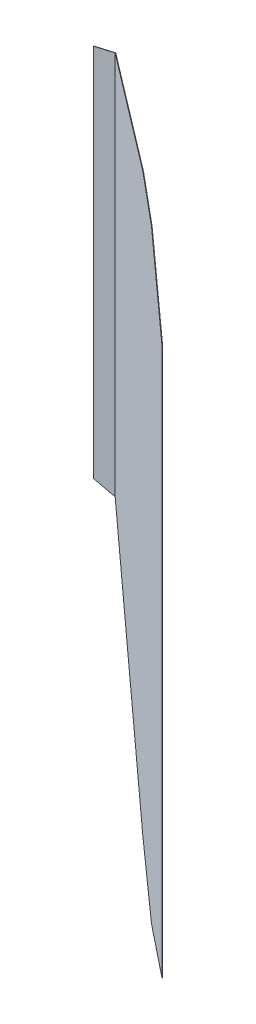
from build123d import *

# Parameters (mm, degrees)
WYCI_GNI_CIE_CIENKA_CIANKA1_DEPTH      = 400
WYCI_GNI_CIE_CIENKA_CIANKA1_DEPTH_BACK = 400


# Read off the part's stored shape, not the designer's step: Lustro1
with BuildPart() as part:
    # Szkic1 → Wyciągnięcie-cienka ścianka1 (new, two sides: drawn at the far end of the back side and taken through both)
    with BuildSketch(Plane(origin=(0, 0, 0), x_dir=(1, 0, 0), z_dir=(0, 1, 0)).offset(-WYCI_GNI_CIE_CIENKA_CIANKA1_DEPTH_BACK)):
        Polygon((961.046281695, -470.048059203), (543.39, -106.98499256), (517.88, -106.98499256), (517.88, -107.48499256), (543.20305766, -107.48499256), (960.718252181, -470.425413993), align=None)
    extrude(amount=WYCI_GNI_CIE_CIENKA_CIANKA1_DEPTH + WYCI_GNI_CIE_CIENKA_CIANKA1_DEPTH_BACK)

    # Cięcie powierzchnią1
    split(bisect_by=Plane(origin=(-24.349944471, -199.016868, -21.167083796), x_dir=(0.7449832908348125, -0.1600276007809854, 0.6476040946173941), z_dir=(-0.12077436340947467, -0.987112540183885, -0.10498755238005406)), keep=Keep.BOTTOM)

    # Cięcie powierzchnią2
    split(bisect_by=Plane(origin=(110.843151094, -553.888363867, 96.354481224), x_dir=(0.7294998198065532, 0.25630205312360615, 0.6341445185971655), z_dir=(0.19343361492315114, -0.9665967398893007, 0.1681492761005468)), keep=Keep.BOTTOM)

    # Cięcie powierzchnią3
    split(bisect_by=Plane(origin=(-14.708403282, -64.029657214, -16.335336758), x_dir=(0.6328754019353329, -0.32469887066665304, 0.7028793417173329), z_dir=(-0.21726595221314635, -0.9458174471787884, -0.24129828557433775)), keep=Keep.BOTTOM)

    # Lustro1
    split(bisect_by=Plane.ZX, keep=Keep.BOTTOM)

    # Lustro1 2: part across plane


with BuildPart() as part_1:
    add(part.part)
    add(part.part.mirror(Plane.ZX))


solid = part_1.part
